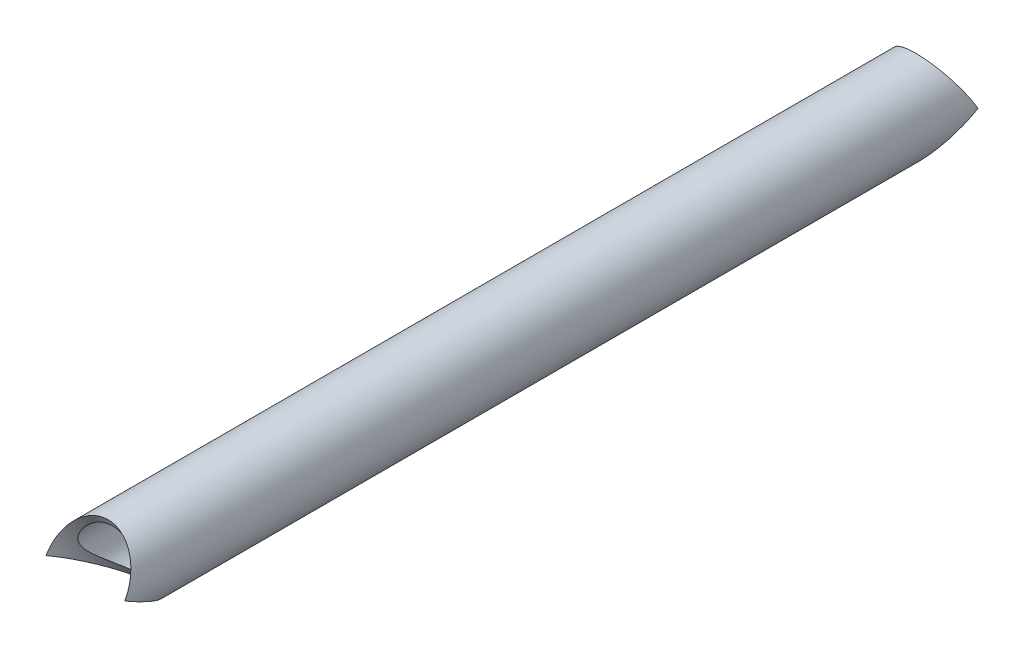
from build123d import *

# Parameters (mm, degrees)
EXTRUDE_START           = -96.897475547
EXTRUDE_1_OUTLINE_R     = 10.65
EXTRUDE_1_OUTLINE_R_2   = 8.65
EXTRUDE_1_DEPTH         = 96.897475547
EXTRUDE_START_2         = -115.343816848
EXTRUDE_1_2_OUTLINE_R   = 10.65
EXTRUDE_1_2_OUTLINE_R_2 = 8.65
EXTRUDE_1_2_DEPTH       = 18.446341301
EXTRUDE_1_3_OUTLINE_W   = 10.65
EXTRUDE_1_3_OUTLINE_H   = 27.732310486


with BuildPart() as part:
    # Бобышка-Вытянуть1: read off the stored shape, not the designer's step
    # Бобышка-Вытянуть1 outline → Бобышка-Вытянуть1 (new body)
    with BuildSketch(Plane.XY.offset(EXTRUDE_START)):
        with Locations((0, -189.930080757)):
            Circle(EXTRUDE_1_OUTLINE_R)
        with Locations((0, -189.930080757)):
            Circle(EXTRUDE_1_OUTLINE_R_2, mode=Mode.SUBTRACT)
    extrude(amount=EXTRUDE_1_DEPTH)

    # Extrude 1 2 outline → Extrude 1 2 (add)
    with BuildSketch(Plane.XY.offset(EXTRUDE_START_2)):
        with Locations((0, -189.930080757)):
            Circle(EXTRUDE_1_2_OUTLINE_R)
        with Locations((0, -189.930080757)):
            Circle(EXTRUDE_1_2_OUTLINE_R_2, mode=Mode.SUBTRACT)
    extrude(amount=EXTRUDE_1_2_DEPTH)

    # Extrude 1 3 outline → Extrude 1 3 (revolve, cut)
    with BuildSketch(Plane(origin=(0, -97.427857926, -168.75), x_dir=(1, 0, 0), z_dir=(0, 0.4999999999998773, 0.8660254037845095))):
        with Locations((5.325, -111.455351147)):
            Rectangle(EXTRUDE_1_3_OUTLINE_W, EXTRUDE_1_3_OUTLINE_H)
    revolve(axis=Axis((0, -97.427857926, -168.75), (0, 0.8660254037845095, -0.4999999999998773)), mode=Mode.SUBTRACT)

    # Зеркальное отражение1: part across plane


with BuildPart() as part_1:
    add(part.part)
    add(part.part.mirror(Plane(origin=(0, -189.930080757, 0), x_dir=(1, 0, 0), z_dir=(0, 0, 1))))


solid = part_1.part
